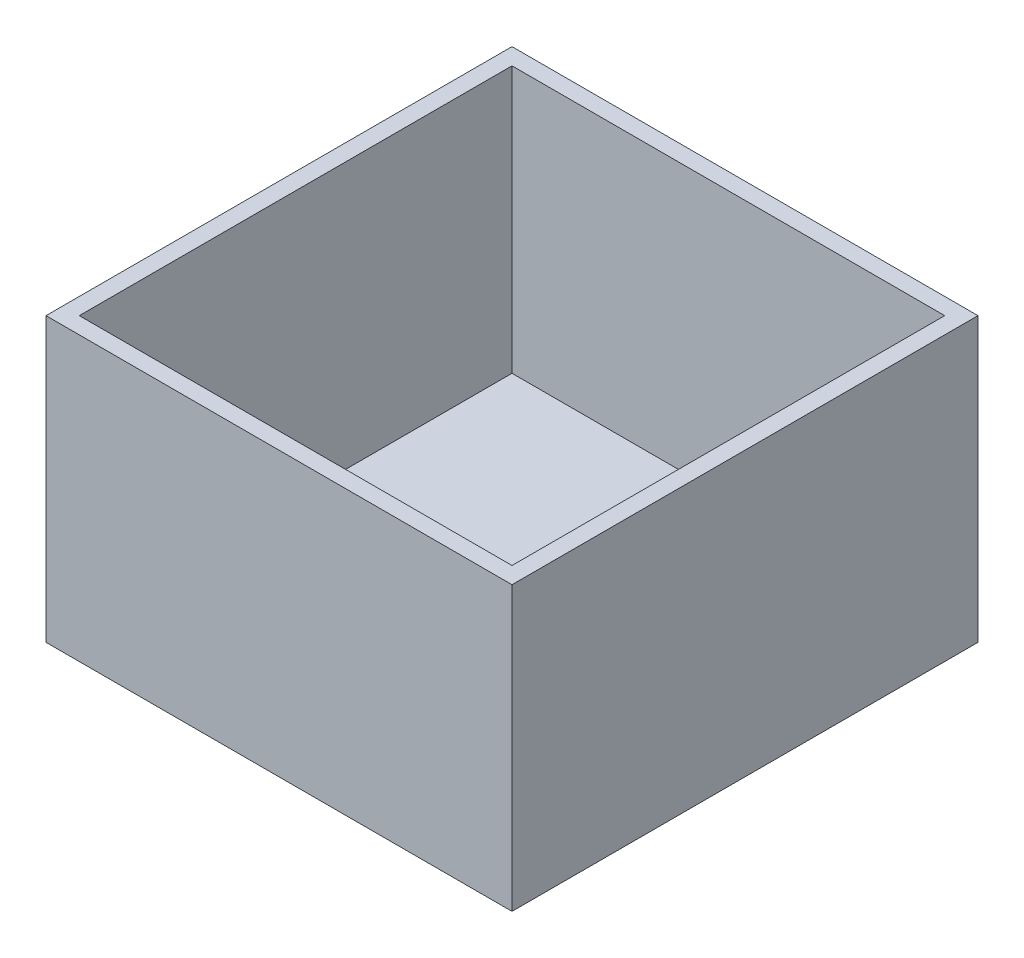
from build123d import *

# Parameters (mm, degrees)
SKETCH1_W           = 56
SKETCH1_H           = 56
BOSS_EXTRUDE1_DEPTH = 2
SKETCH2_W           = 56
SKETCH2_H           = 56
SKETCH2_W_2         = 52
SKETCH2_H_2         = 52
BOSS_EXTRUDE2_DEPTH = 32


with BuildPart() as part:
    # Sketch1 → Boss-Extrude1 (new body)
    with BuildSketch(Plane(origin=(0, 0, 0), x_dir=(1, 0, 0), z_dir=(0, 1, 0))):
        with Locations((28, 28)):
            Rectangle(SKETCH1_W, SKETCH1_H)
    extrude(amount=BOSS_EXTRUDE1_DEPTH)

    # Sketch2 → Boss-Extrude2 (add)
    with BuildSketch(Plane(origin=(0, 2, 0), x_dir=(1, 0, 0), z_dir=(0, 1, 0))):
        with Locations((28, 28)):
            Rectangle(SKETCH2_W, SKETCH2_H)
        with Locations((28, 28)):
            Rectangle(SKETCH2_W_2, SKETCH2_H_2, mode=Mode.SUBTRACT)
    extrude(amount=BOSS_EXTRUDE2_DEPTH)


solid = part.part
